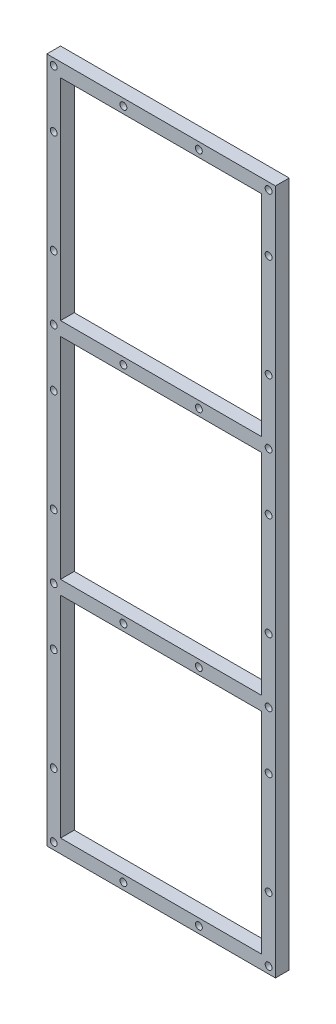
from build123d import *

# Parameters (mm, degrees)
SKETCH1_W           = 100
SKETCH1_H           = 300
SKETCH1_W_2         = 88
SKETCH1_H_2         = 92
BOSS_EXTRUDE1_DEPTH = 6
SKETCH2_R           = 1.5
CUT_EXTRUDE1_DEPTH  = 6
SKETCH3_R           = 1.5
CUT_EXTRUDE2_DEPTH  = 10


with BuildPart() as part:
    # Sketch1 → Boss-Extrude1 (new body)
    with BuildSketch(Plane.XY):
        Rectangle(SKETCH1_W, SKETCH1_H)
        with Locations((0, 98)):
            Rectangle(SKETCH1_W_2, SKETCH1_H_2, mode=Mode.SUBTRACT)
        with Locations((0, -98)):
            Rectangle(SKETCH1_W_2, SKETCH1_H_2, mode=Mode.SUBTRACT)
        Rectangle(SKETCH1_W_2, SKETCH1_H_2, mode=Mode.SUBTRACT)
    extrude(amount=BOSS_EXTRUDE1_DEPTH)

    # Sketch2 → Cut-Extrude1 (cut)
    with BuildSketch(Plane.XY.offset(6)):
        with Locations((-47, 147)):
            Circle(SKETCH2_R)
        with Locations((47, 147)):
            Circle(SKETCH2_R)
        with Locations((47, 49)):
            Circle(SKETCH2_R)
        with Locations((47, -49)):
            Circle(SKETCH2_R)
        with Locations((47, -147)):
            Circle(SKETCH2_R)
        with Locations((-47, 49)):
            Circle(SKETCH2_R)
        with Locations((-47, -49)):
            Circle(SKETCH2_R)
        with Locations((-47, -147)):
            Circle(SKETCH2_R)
    extrude(amount=-CUT_EXTRUDE1_DEPTH, mode=Mode.SUBTRACT)

    # Sketch3 → Cut-Extrude2 (cut)
    with BuildSketch(Plane.XY.offset(6)):
        with Locations((-47, 122)):
            Circle(SKETCH3_R)
        with Locations((-47, 77)):
            Circle(SKETCH3_R)
        with Locations((47, 122)):
            Circle(SKETCH3_R)
        with Locations((47, 77)):
            Circle(SKETCH3_R)
        with Locations((47, 24)):
            Circle(SKETCH3_R)
        with Locations((47, -21)):
            Circle(SKETCH3_R)
        with Locations((47, -74)):
            Circle(SKETCH3_R)
        with Locations((47, -119)):
            Circle(SKETCH3_R)
        with Locations((-47, 24)):
            Circle(SKETCH3_R)
        with Locations((-47, -21)):
            Circle(SKETCH3_R)
        with Locations((-47, -74)):
            Circle(SKETCH3_R)
        with Locations((-47, -119)):
            Circle(SKETCH3_R)
        with Locations((-16.5, 147)):
            Circle(SKETCH3_R)
        with Locations((-16.5, 49)):
            Circle(SKETCH3_R)
        with Locations((-16.5, -49)):
            Circle(SKETCH3_R)
        with Locations((-16.5, -147)):
            Circle(SKETCH3_R)
        with Locations((16.5, -147)):
            Circle(SKETCH3_R)
        with Locations((16.5, -49)):
            Circle(SKETCH3_R)
        with Locations((16.5, 49)):
            Circle(SKETCH3_R)
        with Locations((16.5, 147)):
            Circle(SKETCH3_R)
        with Locations((-47, -49)):
            Circle(SKETCH3_R)
    extrude(amount=-CUT_EXTRUDE2_DEPTH, mode=Mode.SUBTRACT)


solid = part.part
